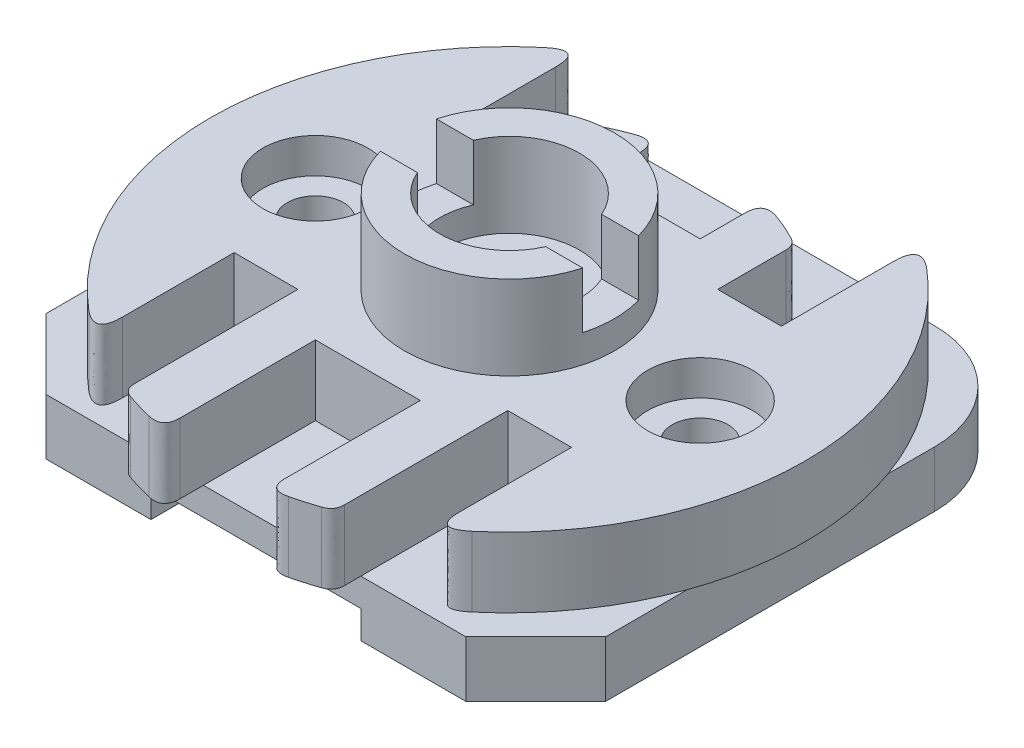
from build123d import *

# Parameters (mm, degrees)
SKETCH2_W                                = 80
SKETCH2_H                                = 72
BOSS_EXTRUDE1_DEPTH                      = 8
BOSS_EXTRUDE2_DEPTH                      = 10
CHAMFER1_SIZE                            = 10
FILLET1_R                                = 15
SKETCH4_R                                = 15
SKETCH4_R_2                              = 10
BOSS_EXTRUDE3_DEPTH                      = 12
SKETCH5_W                                = 8
SKETCH5_H                                = 8
CUT_EXTRUDE1_DEPTH                       = 114.535236821
CBORE_FOR_M10_HEX_HEAD_BOLT1_D           = 8
CBORE_FOR_M10_HEX_HEAD_BOLT1_CBORE_D     = 15
CBORE_FOR_M10_HEX_HEAD_BOLT1_CBORE_DEPTH = 5
SKETCH8_W                                = 30
SKETCH8_H                                = 4
CUT_EXTRUDE2_DEPTH                       = 118.321038589


with BuildPart() as part:
    # Sketch2 → Boss-Extrude1 (new body)
    with BuildSketch(Plane(origin=(0, 0, 0), x_dir=(1, 0, 0), z_dir=(0, 1, 0))):
        with Locations((40, 36)):
            Rectangle(SKETCH2_W, SKETCH2_H)
    extrude(amount=BOSS_EXTRUDE1_DEPTH)

    # Sketch3 → Boss-Extrude2 (add)
    with BuildSketch(Plane(origin=(0, 8, 0), x_dir=(1, 0, 0), z_dir=(0, 1, 0))):
        with BuildLine():
            Line((32.5, 65.047375097), (32.5, 56))
            Line((32.5, 56), (47.5, 56))
            Line((47.5, 56), (47.5, 65.047375097))
            ThreePointArc((47.5, 65.047375097), (51.354009371, 63.768443802), (55, 61.980762114))
            Line((55, 61.980762114), (55, 51))
            Line((55, 51), (64.109126902, 51))
            Line((64.109126902, 51), (64.109126902, 71))
            ThreePointArc((64.109126902, 71), (82.5, 36), (64.109126902, 1))
            Line((64.109126902, 1), (64.109126902, 21))
            Line((64.109126902, 21), (55, 21))
            Line((55, 21), (55, -3.764934301))
            ThreePointArc((55, -3.764934301), (51.297421179, -4.970944274), (47.5, -5.833001327))
            Line((47.5, -5.833001327), (47.5, 16))
            Line((47.5, 16), (32.5, 16))
            Line((32.5, 16), (32.5, -5.833001327))
            ThreePointArc((32.5, -5.833001327), (28.702578821, -4.970944274), (25, -3.764934301))
            Line((25, -3.764934301), (25, 21))
            Line((25, 21), (15.890873098, 21))
            Line((15.890873098, 21), (15.890873098, 1))
            ThreePointArc((15.890873098, 1), (-2.5, 36), (15.890873098, 71))
            Line((15.890873098, 71), (15.890873098, 51))
            Line((15.890873098, 51), (25, 51))
            Line((25, 51), (25, 61.980762114))
            ThreePointArc((25, 61.980762114), (28.645990629, 63.768443802), (32.5, 65.047375097))
        make_face()
    extrude(amount=BOSS_EXTRUDE2_DEPTH)

    # Chamfer1
    chamfer1_edges = [part.edges().sort_by_distance(p)[0] for p in [
        (80, 4, 0),
        (0, 4, 0),
    ]]
    chamfer(chamfer1_edges, length=CHAMFER1_SIZE)

    # Fillet1
    fillet1_edges = [part.edges().sort_by_distance(p)[0] for p in [
        (0, 4, -72),
        (80, 4, -72),
    ]]
    fillet(fillet1_edges, radius=FILLET1_R)

    # Sketch4 → Boss-Extrude3 (add)
    with BuildSketch(Plane(origin=(0, 18, 0), x_dir=(1, 0, 0), z_dir=(0, 1, 0))):
        with Locations(Location((40.253775516, 36, 0), (0, 0, 270))):
            Circle(SKETCH4_R)
        with Locations(Location((40.253775516, 36, 0), (0, 0, 270))):
            Circle(SKETCH4_R_2, mode=Mode.SUBTRACT)
    extrude(amount=BOSS_EXTRUDE3_DEPTH)

    # Sketch5 → Cut-Extrude1 (cut, through all)
    with BuildSketch(Plane(origin=(0, 0, 0), x_dir=(0, 0, -1), z_dir=(1, 0, 0))):
        with Locations((36, 26)):
            Rectangle(SKETCH5_W, SKETCH5_H)
    extrude(amount=CUT_EXTRUDE1_DEPTH, mode=Mode.SUBTRACT)

    # CBORE for M10 Hex Head Bolt1 (through all)
    with Locations(Plane(origin=(0, 18, 0), x_dir=(1, 0, 0), z_dir=(0, 1, 0))):
        with Locations((67.5, 36), (12.5, 36)):
            CounterBoreHole(CBORE_FOR_M10_HEX_HEAD_BOLT1_D / 2, CBORE_FOR_M10_HEX_HEAD_BOLT1_CBORE_D / 2, CBORE_FOR_M10_HEX_HEAD_BOLT1_CBORE_DEPTH)

    # Sketch8 → Cut-Extrude2 (cut, through all)
    with BuildSketch(Plane(origin=(0, 0, -72), x_dir=(-1, 0, 0), z_dir=(0, 0, -1))):
        with Locations((-40, 2)):
            Rectangle(SKETCH8_W, SKETCH8_H)
    extrude(amount=-CUT_EXTRUDE2_DEPTH, mode=Mode.SUBTRACT)

    # Fillet2
    # a fillet whose section is not a circle: 2 mm, written as the material it takes off along each edge
    with BuildSketch(Plane(origin=(64.109126902, 8, -71), x_dir=(0.7949377645481589, 0, 0.6066909843529702), z_dir=(0, 1, 0)), Plane(origin=(15.890873098, 8, -1), x_dir=(-0.7949377645481593, 0, -0.6066909843529693), z_dir=(0, 1, 0))) as fillet2_piece_1:
        with BuildLine():
            Bezier((4.137858015, 0), (-0.159861677, 0.20946427), (2.45062112, -3.211010754), weights=[1, 1, 1])
            Line((2.45062112, -3.211010754), (0, 0))
            ThreePointArc((0, 0), (2.068929007, 0.050388308), (4.137858015, 0))
        make_face()
    extrude(amount=20.344645036, mode=Mode.SUBTRACT)
    with BuildSketch(Plane(origin=(15.890873098, 8, -71), x_dir=(-0.794937764548161, 0, 0.6066909843529674), z_dir=(0, 1, 0)), Plane(origin=(64.109126902, 8, -1), x_dir=(0.7949377645481593, 0, -0.6066909843529698), z_dir=(0, 1, 0))) as fillet2_piece_2:
        with BuildLine():
            Bezier((4.137858015, 0), (-0.159861677, -0.20946427), (2.45062112, 3.211010754), weights=[1, 1, 1])
            Line((2.45062112, 3.211010754), (0, 0))
            ThreePointArc((0, 0), (2.068929007, -0.050388308), (4.137858015, 0))
        make_face()
    extrude(amount=20.344645036, mode=Mode.SUBTRACT)
    with BuildSketch(Plane(origin=(55, 4.393986535, 3.764934301), x_dir=(0, 0, -1), z_dir=(0, 1, 0))) as fillet2_piece_3:
        with BuildLine():
            Bezier((1.408057473, 0), (-0.025844464, 0), (-0.486109283, 1.358024691), weights=[1, 1, 1])
            ThreePointArc((-0.486109283, 1.358024691), (-0.248816298, 0.676949942), (0, 0))
            Line((0, 0), (1.408057473, 0))
        make_face()
    extrude(amount=17.21202693, mode=Mode.SUBTRACT)
    with BuildSketch(Plane(origin=(47.5, 1.692392429, 5.833001327), x_dir=(0, 0, -1), z_dir=(0, 1, 0))) as fillet2_piece_4:
        with BuildLine():
            Bezier((2.462961957, 0), (-0.077040583, 0), (0.518762482, -2.469135802), weights=[1, 1, 1])
            ThreePointArc((0.518762482, -2.469135802), (0.241054451, -1.238418338), (0, 0))
            Line((0, 0), (2.462961957, 0))
        make_face()
    extrude(amount=22.615215142, mode=Mode.SUBTRACT)
    with BuildSketch(Plane(origin=(32.5, 1.692392429, 5.833001327), x_dir=(0, 0, -1), z_dir=(0, 1, 0))) as fillet2_piece_5:
        with BuildLine():
            Bezier((2.462961957, 0), (-0.077040583, 0), (0.518762482, 2.469135802), weights=[1, 1, 1])
            ThreePointArc((0.518762482, 2.469135802), (0.241054451, 1.238418338), (0, 0))
            Line((0, 0), (2.462961957, 0))
        make_face()
    extrude(amount=22.615215142, mode=Mode.SUBTRACT)
    with BuildSketch(Plane(origin=(25, 4.393986535, 3.764934301), x_dir=(0, 0, -1), z_dir=(0, 1, 0))) as fillet2_piece_6:
        with BuildLine():
            Bezier((1.408057473, 0), (-0.025844464, 0), (-0.486109283, -1.358024691), weights=[1, 1, 1])
            ThreePointArc((-0.486109283, -1.358024691), (-0.248816298, -0.676949942), (0, 0))
            Line((0, 0), (1.408057473, 0))
        make_face()
    extrude(amount=17.21202693, mode=Mode.SUBTRACT)
    with BuildSketch(Plane(origin=(55, 8, -61.980762114), x_dir=(0, 0, 1), z_dir=(0, 1, 0))) as fillet2_piece_7:
        with BuildLine():
            Bezier((1.181568578, 0), (-0.02814818, 0), (-0.589802389, -1.071428571), weights=[1, 1, 1])
            ThreePointArc((-0.589802389, -1.071428571), (-0.30036176, -0.532708341), (0, 0))
            Line((0, 0), (1.181568578, 0))
        make_face()
    extrude(amount=13.057599182, mode=Mode.SUBTRACT)
    with BuildSketch(Plane(origin=(47.5, 8, -65.047375097), x_dir=(0, 0, 1), z_dir=(0, 1, 0))) as fillet2_piece_8:
        with BuildLine():
            Bezier((2.708240714, 0), (-0.139233273, 0), (0.826873973, 2.678571429), weights=[1, 1, 1])
            ThreePointArc((0.826873973, 2.678571429), (0.382133114, 1.348949208), (0, 0))
            Line((0, 0), (2.708240714, 0))
        make_face()
    extrude(amount=17.008238663, mode=Mode.SUBTRACT)
    with BuildSketch(Plane(origin=(32.5, 8, -65.047375097), x_dir=(-0.9555080660857783, 0, 0.294964973590113), z_dir=(0, 1, 0))) as fillet2_piece_9:
        with BuildLine():
            Bezier((2.803295465, 0), (-0.041068939, -0.133038515), (0.798836151, 2.587745848), weights=[1, 1, 1])
            Line((0.798836151, 2.587745848), (0, 0))
            ThreePointArc((0, 0), (1.401647733, -0.032761495), (2.803295465, 0))
        make_face()
    extrude(amount=17.008238663, mode=Mode.SUBTRACT)
    with BuildSketch(Plane(origin=(25, 8, -61.980762114), x_dir=(0, 0, 1), z_dir=(0, 1, 0))) as fillet2_piece_10:
        with BuildLine():
            Bezier((1.181568578, 0), (-0.02814818, 0), (-0.589802389, 1.071428571), weights=[1, 1, 1])
            ThreePointArc((-0.589802389, 1.071428571), (-0.30036176, 0.532708341), (0, 0))
            Line((0, 0), (1.181568578, 0))
        make_face()
    extrude(amount=13.057599182, mode=Mode.SUBTRACT)


solid = part.part
